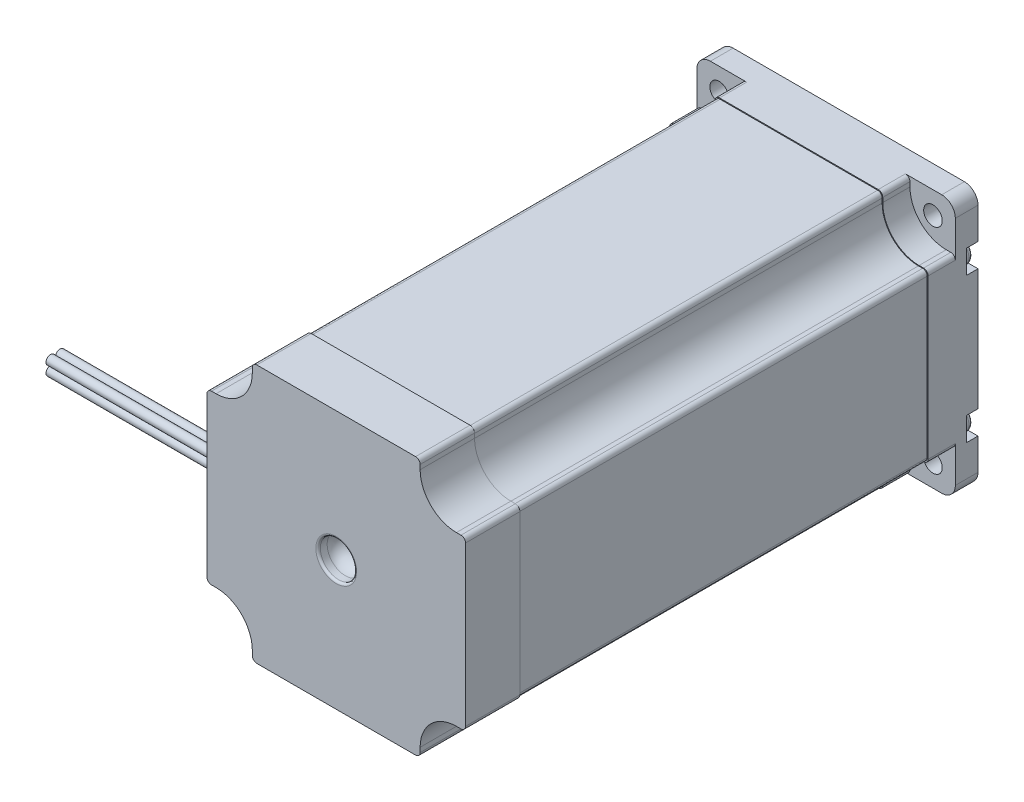
from build123d import *

# Parameters (mm, degrees)
SKETCH1_R             = 2.05
BOSS_EXTRUDE1_DEPTH   = 113
CUT_EXTRUDE1_DEPTH    = 108
FILLET1_R             = 8
FILLET2_R             = 1
SKETCH3_W             = 76.62604108
SKETCH3_H             = 74.099907857
CUT_EXTRUDE2_DEPTH    = 90
SKETCH4_R             = 19.05
BOSS_EXTRUDE2_DEPTH   = 1.6
SKETCH5_R             = 4
BOSS_EXTRUDE3_DEPTH   = 22.4
SKETCH6_W             = 13.988854573
SKETCH6_H             = 2.996815592
CUT_EXTRUDE3_DEPTH    = 20
SKETCH7_R             = 1
BOSS_EXTRUDE4_DEPTH   = 40
FILLET3_R             = 0.5
CUT_EXTRUDE4_DEPTH    = 2.5
SKETCH9_R             = 2.5
BOSS_EXTRUDE5_DEPTH   = 2
BOSS_EXTRUDE5_2_DEPTH = 2
BOSS_EXTRUDE5_3_DEPTH = 2
BOSS_EXTRUDE5_4_DEPTH = 2
FILLET4_R             = 1
FILLET5_R             = 1
FILLET6_R             = 1
FILLET7_R             = 1
CUT_EXTRUDE6_DEPTH    = 1
SKETCH11_R            = 4
CUT_EXTRUDE7_DEPTH    = 5
FILLET8_R             = 3
FILLET9_R             = 0.5


with BuildPart() as part:
    # Sketch1 → Boss-Extrude1 (new body)
    with BuildSketch(Plane.XY):
        with BuildLine():
            Line((-3, 0), (-54, 0))
            ThreePointArc((-54, 0), (-56.121320344, 0.878679656), (-57, 3))
            Line((-57, 3), (-57, 54))
            ThreePointArc((-57, 54), (-56.121320344, 56.121320344), (-54, 57))
            Line((-54, 57), (-3, 57))
            ThreePointArc((-3, 57), (-0.878679656, 56.121320344), (0, 54))
            Line((0, 54), (0, 3))
            ThreePointArc((0, 3), (-0.878679656, 0.878679656), (-3, 0))
        make_face()
        with Locations((-52.07, 52.07)):
            Circle(SKETCH1_R, mode=Mode.SUBTRACT)
        with Locations(Location((-4.93, 52.07, 0), (0, 0, 180))):
            Circle(SKETCH1_R, mode=Mode.SUBTRACT)
        with Locations((-4.93, 4.93)):
            Circle(SKETCH1_R, mode=Mode.SUBTRACT)
        with Locations(Location((-52.07, 4.93, 0), (0, 0, 180))):
            Circle(SKETCH1_R, mode=Mode.SUBTRACT)
    extrude(amount=BOSS_EXTRUDE1_DEPTH)

    # Sketch2 → Cut-Extrude1 (cut)
    with BuildSketch(Plane.XY.offset(113)):
        Polygon((-80.82434592, 69.667794166), (-80.82434592, -15.536407838), (13.134783263, -15.536407838), (13.134783263, 68.104414313), align=None)
        Polygon((-47, 60.029369012), (-47, 47), (-64.040840401, 47), (-64.040840401, 10), (-47, 10), (-47, -4.539432636), (-10, -4.539432636), (-10, 10), (8.545640599, 10), (8.545640599, 47), (-10, 47), (-10, 60.029369012), align=None, mode=Mode.SUBTRACT)
    extrude(amount=-CUT_EXTRUDE1_DEPTH, mode=Mode.SUBTRACT)

    # Fillet1
    fillet1_edges = [part.edges().sort_by_distance(p)[0] for p in [
        (-10, 10, 59),
        (-10, 47, 59),
        (-47, 47, 59),
        (-47, 10, 59),
    ]]
    fillet(fillet1_edges, radius=FILLET1_R)

    # Fillet2
    fillet2_edges = [part.edges().sort_by_distance(p)[0] for p in [
        (-47, 0, 59),
        (-10, 0, 59),
        (-57, 47, 59),
        (-57, 10, 59),
        (-47, 57, 59),
        (-10, 57, 59),
        (0, 10, 59),
        (0, 47, 59),
    ]]
    fillet(fillet2_edges, radius=FILLET2_R)

    # Sketch3 → Cut-Extrude2 (cut)
    with BuildSketch(Plane.XY.offset(101)):
        with Locations((-26.371696818, 24.990618746)):
            Rectangle(SKETCH3_W, SKETCH3_H)
        with BuildLine():
            Line((-45.867059297, 56.8), (-11.132940703, 56.8))
            ThreePointArc((-11.132940703, 56.8), (-10.425833922, 56.507106781), (-10.132940703, 55.8))
            Line((-10.132940703, 55.8), (-10.132940703, 54.850578551))
            ThreePointArc((-10.132940703, 54.850578551), (-7.789794953, 49.193724302), (-2.132940703, 46.850578551))
            Line((-2.132940703, 46.850578551), (-1.2, 46.850578551))
            ThreePointArc((-1.2, 46.850578551), (-0.492893219, 46.557685332), (-0.2, 45.850578551))
            Line((-0.2, 45.850578551), (-0.2, 11.182165518))
            ThreePointArc((-0.2, 11.182165518), (-0.492893219, 10.475058736), (-1.2, 10.182165518))
            Line((-1.2, 10.182165518), (-2.0825574, 10.182165518))
            ThreePointArc((-2.0825574, 10.182165518), (-7.739411649, 7.839019767), (-10.0825574, 2.182165518))
            Line((-10.0825574, 2.182165518), (-10.0825574, 1.2))
            ThreePointArc((-10.0825574, 1.2), (-10.375450618, 0.492893219), (-11.0825574, 0.2))
            Line((-11.0825574, 0.2), (-45.9174426, 0.2))
            ThreePointArc((-45.9174426, 0.2), (-46.624549382, 0.492893219), (-46.9174426, 1.2))
            Line((-46.9174426, 1.2), (-46.9174426, 2.182165518))
            ThreePointArc((-46.9174426, 2.182165518), (-49.260588351, 7.839019767), (-54.9174426, 10.182165518))
            Line((-54.9174426, 10.182165518), (-55.8, 10.182165518))
            ThreePointArc((-55.8, 10.182165518), (-56.507106781, 10.475058736), (-56.8, 11.182165518))
            Line((-56.8, 11.182165518), (-56.8, 45.850578551))
            ThreePointArc((-56.8, 45.850578551), (-56.507106781, 46.557685332), (-55.8, 46.850578551))
            Line((-55.8, 46.850578551), (-54.867059297, 46.850578551))
            ThreePointArc((-54.867059297, 46.850578551), (-49.210205047, 49.193724302), (-46.867059297, 54.850578551))
            Line((-46.867059297, 54.850578551), (-46.867059297, 55.8))
            ThreePointArc((-46.867059297, 55.8), (-46.574166078, 56.507106781), (-45.867059297, 56.8))
        make_face(mode=Mode.SUBTRACT)
    extrude(amount=-CUT_EXTRUDE2_DEPTH, mode=Mode.SUBTRACT)

    # Sketch4 → Boss-Extrude2 (add)
    with BuildSketch(Plane(origin=(0, 0, 0), x_dir=(-1, 0, 0), z_dir=(0, 0, -1))):
        with Locations(Location((28.5, 28.5, 0), (0, 0, 180))):
            Circle(SKETCH4_R)
    extrude(amount=BOSS_EXTRUDE2_DEPTH)

    # Sketch5 → Boss-Extrude3 (add)
    with BuildSketch(Plane(origin=(0, 0, -1.6), x_dir=(-1, 0, 0), z_dir=(0, 0, -1))):
        with Locations((28.5, 28.5)):
            Circle(SKETCH5_R)
    extrude(amount=BOSS_EXTRUDE3_DEPTH)

    # Sketch6 → Cut-Extrude3 (cut)
    with BuildSketch(Plane(origin=(0, 0, -24), x_dir=(-1, 0, 0), z_dir=(0, 0, -1))):
        with Locations((28.916334958, 33.498407796)):
            Rectangle(SKETCH6_W, SKETCH6_H)
    extrude(amount=-CUT_EXTRUDE3_DEPTH, mode=Mode.SUBTRACT)

    # Sketch7 → Boss-Extrude4 (add)
    with BuildSketch(Plane.ZY.offset(57)):
        with Locations(Location((105.390614569, 29.750650168, 0), (0, 0, 180))):
            Circle(SKETCH7_R)
        with Locations(Location((107.490614569, 29.750650168, 0), (0, 0, 180))):
            Circle(SKETCH7_R)
        with Locations(Location((107.490614569, 27.650650168, 0), (0, 0, 180))):
            Circle(SKETCH7_R)
        with Locations(Location((105.390614569, 27.650650168, 0), (0, 0, 180))):
            Circle(SKETCH7_R)
    extrude(amount=BOSS_EXTRUDE4_DEPTH)

    # Fillet3
    fillet3_edges = [part.edges().sort_by_distance(p)[0] for p in [
        (-47.55, 28.5, -1.6),
    ]]
    fillet(fillet3_edges, radius=FILLET3_R)

    # Sketch8 → Cut-Extrude4 (cut)
    with BuildSketch(Plane(origin=(0, 0, 0), x_dir=(-1, 0, 0), z_dir=(0, 0, -1))):
        with BuildLine():
            Line((3, 47.07), (-1.614626153, 47.07))
            Line((-1.614626153, 47.07), (-1.614626153, 41.87))
            Line((-1.614626153, 41.87), (3, 41.87))
            ThreePointArc((3, 41.87), (5.6, 44.47), (3, 47.07))
        make_face()
        with BuildLine():
            Line((-1.614626153, 15.13), (3, 15.13))
            ThreePointArc((3, 15.13), (5.6, 12.53), (3, 9.93))
            Line((3, 9.93), (-1.614626153, 9.93))
            Line((-1.614626153, 9.93), (-1.614626153, 15.13))
        make_face()
        with BuildLine():
            Line((58.614626153, 9.93), (58.614626153, 15.13))
            Line((58.614626153, 15.13), (54, 15.13))
            ThreePointArc((54, 15.13), (51.4, 12.53), (54, 9.93))
            Line((54, 9.93), (58.614626153, 9.93))
        make_face()
        with BuildLine():
            Line((58.614626153, 41.87), (54, 41.87))
            ThreePointArc((54, 41.87), (51.4, 44.47), (54, 47.07))
            Line((54, 47.07), (58.614626153, 47.07))
            Line((58.614626153, 47.07), (58.614626153, 41.87))
        make_face()
    extrude(amount=-CUT_EXTRUDE4_DEPTH, mode=Mode.SUBTRACT)

    # Sketch11 → Cut-Extrude7 (cut)
    with BuildSketch(Plane.XY.offset(113)):
        with Locations(Location((-28.5, 28.5, 0), (0, 0, 61.044975628))):
            Circle(SKETCH11_R)
    extrude(amount=-CUT_EXTRUDE7_DEPTH, mode=Mode.SUBTRACT)

    # Fillet8
    fillet8_edges = [part.edges().sort_by_distance(p)[0] for p in [
        (-30.436491673, 25, 108),
    ]]
    fillet(fillet8_edges, radius=FILLET8_R)

    # Fillet9
    fillet9_edges = [part.edges().sort_by_distance(p)[0] for p in [
        (-30.436491673, 25, 113),
    ]]
    fillet(fillet9_edges, radius=FILLET9_R)


with BuildPart() as body_2:
    # Sketch9 → Boss-Extrude5 (new body)
    with BuildSketch(Plane(origin=(0, 0, 2.5), x_dir=(-1, 0, 0), z_dir=(0, 0, -1))):
        with Locations((3, 44.47)):
            Circle(SKETCH9_R)
    extrude(amount=BOSS_EXTRUDE5_DEPTH)

    # Fillet4
    fillet4_edges = [body_2.edges().sort_by_distance(p)[0] for p in [
        (-0.5, 44.47, 2.5),
        (-0.5, 44.47, 0.5),
    ]]
    fillet(fillet4_edges, radius=FILLET4_R - 0.0001)  # a hair under: the kernel refuses the full size


with BuildPart() as body_3:
    # Sketch9 → Boss-Extrude5 2 (new body)
    with BuildSketch(Plane(origin=(0, 0, 2.5), x_dir=(-1, 0, 0), z_dir=(0, 0, -1))):
        with Locations(Location((54, 44.47, 0), (0, 0, 180))):
            Circle(SKETCH9_R)
    extrude(amount=BOSS_EXTRUDE5_2_DEPTH)

    # Fillet7
    fillet7_edges = [body_3.edges().sort_by_distance(p)[0] for p in [
        (-56.5, 44.47, 2.5),
        (-56.5, 44.47, 0.5),
    ]]
    fillet(fillet7_edges, radius=FILLET7_R - 0.0001)  # a hair under: the kernel refuses the full size


with BuildPart() as body_4:
    # Sketch9 → Boss-Extrude5 3 (new body)
    with BuildSketch(Plane(origin=(0, 0, 2.5), x_dir=(-1, 0, 0), z_dir=(0, 0, -1))):
        with Locations((54, 12.53)):
            Circle(SKETCH9_R)
    extrude(amount=BOSS_EXTRUDE5_3_DEPTH)

    # Fillet6
    fillet6_edges = [body_4.edges().sort_by_distance(p)[0] for p in [
        (-51.5, 12.53, 2.5),
        (-51.5, 12.53, 0.5),
    ]]
    fillet(fillet6_edges, radius=FILLET6_R - 0.0001)  # a hair under: the kernel refuses the full size


with BuildPart() as body_5:
    # Sketch9 → Boss-Extrude5 4 (new body)
    with BuildSketch(Plane(origin=(0, 0, 2.5), x_dir=(-1, 0, 0), z_dir=(0, 0, -1))):
        with Locations(Location((3, 12.53, 0), (0, 0, 180))):
            Circle(SKETCH9_R)
    extrude(amount=BOSS_EXTRUDE5_4_DEPTH)

    # Fillet5
    fillet5_edges = [body_5.edges().sort_by_distance(p)[0] for p in [
        (-5.5, 12.53, 2.5),
        (-5.5, 12.53, 0.5),
    ]]
    fillet(fillet5_edges, radius=FILLET5_R - 0.0001)  # a hair under: the kernel refuses the full size


with BuildPart() as cut_extrude6_tool:
    # Sketch10 → Cut-Extrude6 (new body)
    with BuildSketch(Plane(origin=(0, 0, 0.5), x_dir=(-1, 0, 0), z_dir=(0, 0, -1))):
        Polygon((2.061753803, 44.67), (2.061753803, 44.27), (2.8, 44.27), (2.8, 43.500458888), (3.2, 43.500458888), (3.2, 44.27), (3.938246197, 44.27), (3.938246197, 44.67), (3.2, 44.67), (3.2, 45.439541112), (2.8, 45.439541112), (2.8, 44.67), align=None)
        Polygon((54.2, 45.439541112), (53.8, 45.439541112), (53.8, 44.67), (53.061753803, 44.67), (53.061753803, 44.27), (53.8, 44.27), (53.8, 43.500458888), (54.2, 43.500458888), (54.2, 44.27), (54.938246197, 44.27), (54.938246197, 44.67), (54.2, 44.67), align=None)
        Polygon((53.8, 11.560458888), (53.8, 12.33), (53.061753803, 12.33), (53.061753803, 12.73), (53.8, 12.73), (53.8, 13.499541112), (54.2, 13.499541112), (54.2, 12.73), (54.938246197, 12.73), (54.938246197, 12.33), (54.2, 12.33), (54.2, 11.560458888), align=None)
        Polygon((3.2, 11.560458888), (3.2, 12.33), (3.938246197, 12.33), (3.938246197, 12.73), (3.2, 12.73), (3.2, 13.499541112), (2.8, 13.499541112), (2.8, 12.73), (2.061753803, 12.73), (2.061753803, 12.33), (2.8, 12.33), (2.8, 11.560458888), align=None)
    extrude(amount=-CUT_EXTRUDE6_DEPTH)


with BuildPart() as body_2_1:
    add(body_2.part)

    # Cut-Extrude6: cut by cut_extrude6_tool
    add(cut_extrude6_tool.part, mode=Mode.SUBTRACT)


with BuildPart() as body_3_1:
    add(body_3.part)

    # Cut-Extrude6: cut by cut_extrude6_tool
    add(cut_extrude6_tool.part, mode=Mode.SUBTRACT)


with BuildPart() as body_4_1:
    add(body_4.part)

    # Cut-Extrude6: cut by cut_extrude6_tool
    add(cut_extrude6_tool.part, mode=Mode.SUBTRACT)


with BuildPart() as body_5_1:
    add(body_5.part)

    # Cut-Extrude6: cut by cut_extrude6_tool
    add(cut_extrude6_tool.part, mode=Mode.SUBTRACT)


solid = Compound([part.part, body_2_1.part, body_3_1.part, body_4_1.part, body_5_1.part])
